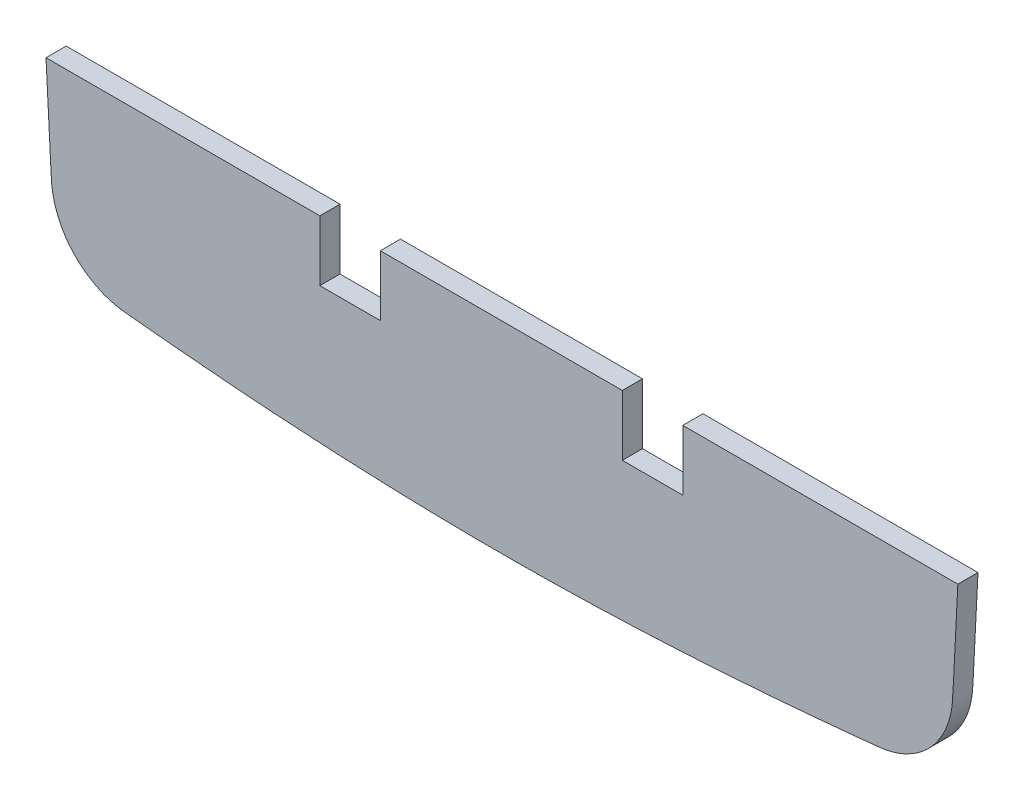
from build123d import *

# Parameters (mm, degrees)
BOSS_EXTRUDE1_DEPTH = 2.54


with BuildPart() as part:
    # Sketch1 → Boss-Extrude1 (new body)
    with BuildSketch(Plane.XY):
        with BuildLine():
            Line((40.64, -46.08145306), (40.64, -38.46145306))
            Line((40.64, -38.46145306), (6.147543162, -38.46145306))
            add(Edge.make_bspline(
                [(121.001569368, -38.46145306), (120.915864502, -40.397908342), (120.826096314, -42.285921611), (120.733404589, -44.125453025), (120.615612775, -46.463113043), (120.493078302, -48.72261096), (120.367809739, -50.904403447), (120.352151168, -51.177127508), (120.339766387, -51.448236325), (120.291569917, -51.991047057), (120.257050589, -52.262374806), (120.212203117, -52.532474303), (120.122508173, -53.072673295), (119.991494884, -53.607904883), (119.64846076, -54.651353518), (119.435785179, -55.15959349), (119.185465817, -55.646583321), (119.060306136, -55.890078237), (118.925903301, -56.128268554), (118.783005312, -56.360251472), (118.711556317, -56.476242931), (118.637983094, -56.59068335), (118.52457324, -56.759855356), (118.486261591, -56.815831304), (118.428048371, -56.899153332), (118.408519672, -56.926820362), (118.379042268, -56.96815799), (118.36918574, -56.981910047), (118.35435512, -57.002497098), (118.349403942, -57.009352609), (118.34196575, -57.01962558), (118.339484448, -57.023048188), (118.334518042, -57.029889964), (118.332715243, -57.032371563), (118.329545934, -57.03672658), (117.923874479, -57.594168806), (117.464270704, -58.108807243), (116.460768945, -59.027607225), (115.918064183, -59.432921076), (114.783752734, -60.122047276), (114.192141465, -60.404552634), (112.991410028, -60.843888296), (112.382291576, -61.001848892), (111.779333415, -61.101550758), (111.628593874, -61.126476225), (111.478235499, -61.147759964), (111.178731774, -61.183149532), (111.029571113, -61.197595131), (110.880426107, -61.213118515), (110.582136094, -61.244165282), (110.28451492, -61.274924472), (109.987560729, -61.305395719), (109.393652347, -61.366338213), (108.802411851, -61.42612886), (108.213825007, -61.484765627), (107.036651319, -61.602039161), (105.870091482, -61.714696043), (104.714040917, -61.822733858), (102.401939789, -62.038809487), (100.131853951, -62.236384639), (97.90312163, -62.415674038), (96.78875547, -62.505318738), (95.684740588, -62.590403368), (94.591039995, -62.670999956), (94.044189699, -62.711298249), (93.499918071, -62.75047473), (92.958221057, -62.788539553), (92.68737255, -62.807571964), (92.417167702, -62.826326472), (92.14760604, -62.844804417), (92.012825209, -62.85404339), (91.878205174, -62.863213222), (91.676516233, -62.876864517), (91.609326771, -62.881397707), (91.508602845, -62.888171661), (91.475038247, -62.89042534), (91.424706416, -62.893799406), (91.40793165, -62.894923019), (91.382773267, -62.896606826), (91.374387767, -62.897167826), (91.357618023, -62.898289288), (91.35053768, -62.898762624), (91.340850161, -62.899409945), (86.380840504, -63.230838094), (81.532485227, -63.47480247), (72.055182745, -63.792266059), (67.424880287, -63.865774692), (58.388446453, -63.856857303), (53.758118088, -63.774522082), (49.014872113, -63.607126591), (46.643249125, -63.523428846), (44.243383201, -63.418564865), (41.815089862, -63.292110765), (40.600943192, -63.228883715), (39.379691515, -63.160257035), (38.151296625, -63.08620829), (37.53709918, -63.049183917), (36.921114987, -63.010805643), (36.303336874, -62.971074951), (35.994447818, -62.951209605), (35.685110276, -62.931006168), (35.375323318, -62.910464902), (35.220429839, -62.900194269), (35.065424006, -62.889839179), (34.832746547, -62.874179917), (34.755159276, -62.868939058), (34.638736169, -62.86104612), (34.599921434, -62.858409866), (34.541688778, -62.854447573), (34.522276134, -62.853125491), (34.493154529, -62.851140389), (34.483446888, -62.850478359), (34.464030726, -62.849153639), (34.452960623, -62.848397968), (34.444613244, -62.84782793), (30.170755013, -62.555968736), (25.729492125, -62.194102902), (21.116943139, -61.758897127), (19.963805892, -61.650095683), (18.799932971, -61.536742676), (17.625218242, -61.418840661), (17.33153956, -61.389365158), (17.037183205, -61.359605431), (16.742147395, -61.329561703), (16.59462949, -61.314539839), (16.446941721, -61.299446976), (16.151226, -61.269119321), (16.003349326, -61.255023779), (15.854869779, -61.237641921), (15.260951589, -61.168114486), (14.657293631, -61.042169338), (13.459164529, -60.670630752), (12.864692469, -60.424741796), (11.715185923, -59.807596235), (11.160148962, -59.437517554), (10.121366346, -58.586998123), (9.638238645, -58.105957872), (9.20594949, -57.577988148), (8.989804912, -57.314003287), (8.786091498, -57.038574555), (8.595972368, -56.753561692), (8.500912802, -56.611055261), (8.409252228, -56.466153612), (8.277081741, -56.245564375), (8.233911668, -56.171495221), (8.170514666, -56.059627347), (8.149608686, -56.022210702), (8.118592756, -55.965900354), (8.108311286, -55.947099342), (8.092975283, -55.918852186), (8.087877648, -55.909428862), (8.080252802, -55.895282555), (8.077714787, -55.890565232), (8.072645968, -55.881126828), (8.069553305, -55.875355714), (8.067587971, -55.871682794), (7.56446251, -54.93141534), (7.204615156, -53.905597104), (7.004368672, -52.853697277), (6.954307051, -52.59072232), (6.914057026, -52.32617755), (6.85339363, -51.796063453), (6.836178709, -51.531044992), (6.820433589, -51.26517225), (6.788943349, -50.733426765), (6.757589257, -50.196754915), (6.726400214, -49.655147223), (6.601644043, -47.488716454), (6.479505127, -45.243293511), (6.288512455, -41.463880353), (6.216835356, -39.978237569), (6.147543162, -38.46145306)],
                knots=[0.336350967, 0.336350967, 0.336350967, 0.336350967, 0.338308458, 0.338308458, 0.338308458, 0.343283582, 0.343283582, 0.343283582, 0.348258706, 0.348258706, 0.353233831, 0.353233831, 0.353233831, 0.358208955, 0.358208955, 0.36318408, 0.36318408, 0.36318408, 0.368159204, 0.368159204, 0.368159204, 0.373134328, 0.373134328, 0.378109453, 0.378109453, 0.383084577, 0.383084577, 0.388059701, 0.388059701, 0.393034826, 0.393034826, 0.39800995, 0.39800995, 0.402985075, 0.402985075, 0.402985075, 0.407960199, 0.407960199, 0.412935323, 0.412935323, 0.417910448, 0.417910448, 0.422885572, 0.422885572, 0.422885572, 0.427860697, 0.427860697, 0.432835821, 0.432835821, 0.432835821, 0.437810945, 0.437810945, 0.437810945, 0.44278607, 0.44278607, 0.44278607, 0.447761194, 0.447761194, 0.447761194, 0.452736318, 0.452736318, 0.452736318, 0.457711443, 0.457711443, 0.457711443, 0.462686567, 0.462686567, 0.462686567, 0.467661692, 0.467661692, 0.467661692, 0.472636816, 0.472636816, 0.47761194, 0.47761194, 0.482587065, 0.482587065, 0.487562189, 0.487562189, 0.492537313, 0.492537313, 0.497512438, 0.497512438, 0.497512438, 0.502487562, 0.502487562, 0.507462687, 0.507462687, 0.512437811, 0.512437811, 0.512437811, 0.517412935, 0.517412935, 0.517412935, 0.52238806, 0.52238806, 0.52238806, 0.527363184, 0.527363184, 0.527363184, 0.532338308, 0.532338308, 0.532338308, 0.537313433, 0.537313433, 0.542288557, 0.542288557, 0.547263682, 0.547263682, 0.552238806, 0.552238806, 0.55721393, 0.55721393, 0.562189055, 0.562189055, 0.562189055, 0.567164179, 0.567164179, 0.567164179, 0.572139303, 0.572139303, 0.572139303, 0.577114428, 0.577114428, 0.577114428, 0.582089552, 0.582089552, 0.587064677, 0.587064677, 0.587064677, 0.592039801, 0.592039801, 0.597014925, 0.597014925, 0.60199005, 0.60199005, 0.606965174, 0.606965174, 0.606965174, 0.611940299, 0.611940299, 0.611940299, 0.616915423, 0.616915423, 0.621890547, 0.621890547, 0.626865672, 0.626865672, 0.631840796, 0.631840796, 0.63681592, 0.63681592, 0.641791045, 0.641791045, 0.646766169, 0.646766169, 0.646766169, 0.651741294, 0.651741294, 0.651741294, 0.656716418, 0.656716418, 0.661691542, 0.661691542, 0.661691542, 0.666666667, 0.666666667, 0.666666667, 0.671641791, 0.671641791, 0.674754422, 0.674754422, 0.674754422, 0.674754422], degree=3))
            Line((121.001569368, -38.46145306), (86.36, -38.46145306))
            Line((86.36, -38.46145306), (86.36, -46.08145306))
            Line((86.36, -46.08145306), (78.74, -46.08145306))
            Line((78.74, -46.08145306), (78.74, -38.46145306))
            Line((78.74, -38.46145306), (48.26, -38.46145306))
            Line((48.26, -38.46145306), (48.26, -46.08145306))
            Line((48.26, -46.08145306), (40.64, -46.08145306))
        make_face()
    extrude(amount=BOSS_EXTRUDE1_DEPTH)


solid = part.part
